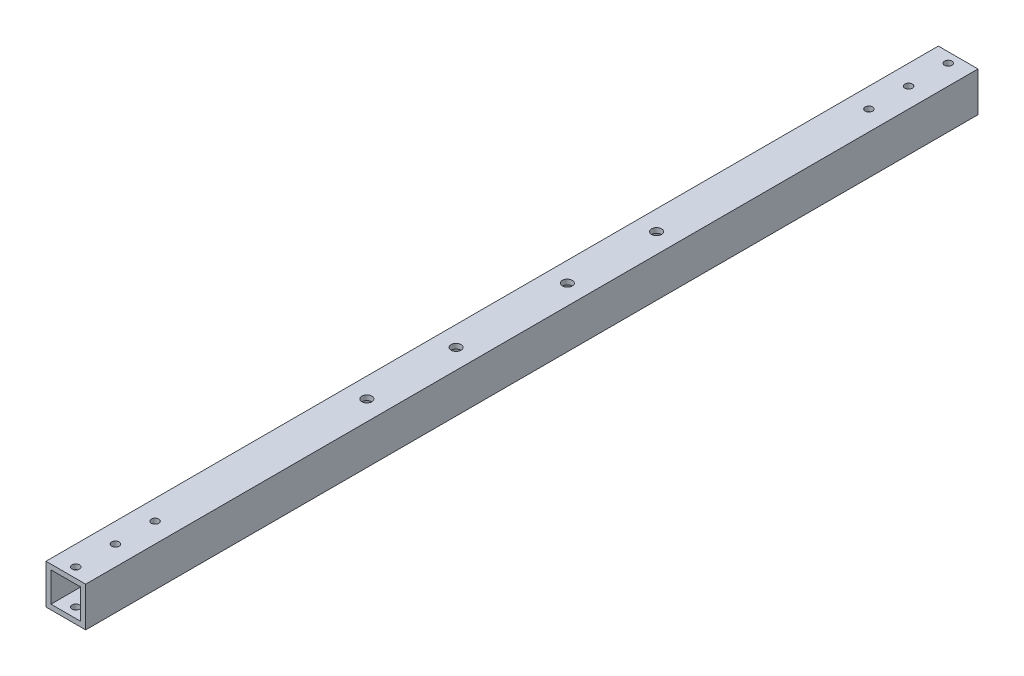
from build123d import *

# Parameters (mm, degrees)
SKETCH1_W                      = 25.4
SKETCH1_H                      = 25.4
SKETCH1_W_2                    = 19.05
SKETCH1_H_2                    = 19.05
EXTRUDE_THIN1_DEPTH            = 571.5
F_3_16_0_1875_DIAMETER_HOLE1_D = 4.7625
F_1_4_0_25_DIAMETER_HOLE1_D    = 6.35


with BuildPart() as part:
    # Sketch1 → Extrude-Thin1 (new body)
    with BuildSketch(Plane.XY):
        Rectangle(SKETCH1_W, SKETCH1_H)
        Rectangle(SKETCH1_W_2, SKETCH1_H_2, mode=Mode.SUBTRACT)
    extrude(amount=EXTRUDE_THIN1_DEPTH)

    # 3/16 (0.1875) Diameter Hole1 (through all)
    with Locations(Plane(origin=(0, 12.7, 565.15), x_dir=(0, 0, 1), z_dir=(0, 1, 0))):
        with Locations((0, 0), (-558.8, 0), (-533.4, 0), (-508, 0), (-25.4, 0), (-50.8, 0)):
            Hole(F_3_16_0_1875_DIAMETER_HOLE1_D / 2)

    # 1/4 (0.25) Diameter Hole1 (through all)
    with Locations(Plane(origin=(0, 12.7, 0), x_dir=(1, 0, 0), z_dir=(0, 1, 0))):
        with Locations((0, -321.564), (0, -378.714), (0, -193.167), (0, -250.317)):
            Hole(F_1_4_0_25_DIAMETER_HOLE1_D / 2)


solid = part.part
